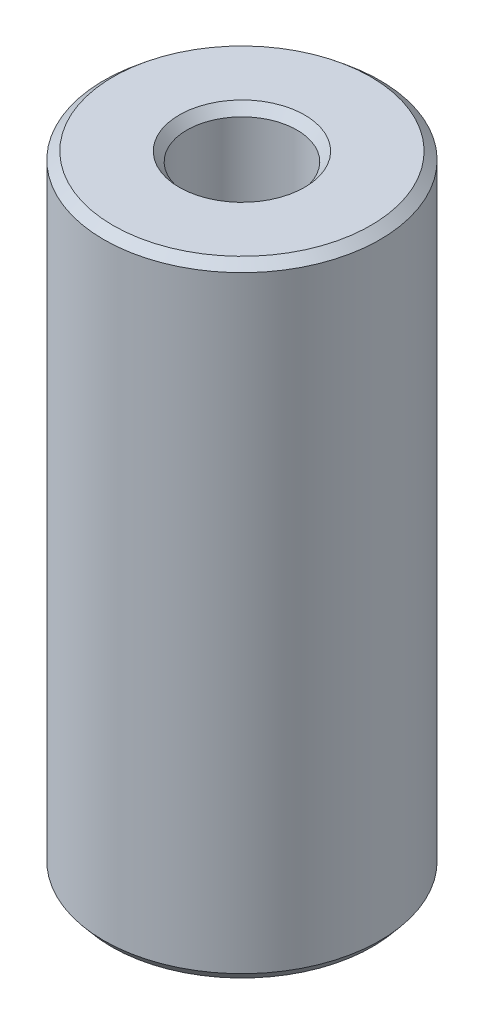
from build123d import *
from OCP.BRepFilletAPI import BRepFilletAPI_MakeChamfer

# Parameters (mm, degrees)
SKETCH1_R           = 17.5
BOSS_EXTRUDE1_DEPTH = 79.117678604
SKETCH2_R           = 6.978931383
CUT_EXTRUDE1_DEPTH  = 83.898172885
CHAMFER1_SIZE       = 0.973704251
CHAMFER1_SIZE2      = 1.167444836


with BuildPart() as part:
    # Sketch1 → Boss-Extrude1 (new body)
    with BuildSketch(Plane(origin=(0, 0, 0), x_dir=(1, 0, 0), z_dir=(0, 1, 0))):
        Circle(SKETCH1_R)
    extrude(amount=BOSS_EXTRUDE1_DEPTH)

    # Sketch2 → Cut-Extrude1 (cut, through all)
    with BuildSketch(Plane(origin=(0, 0, 0), x_dir=(1, 0, 0), z_dir=(0, 1, 0))):
        Circle(SKETCH2_R)
    extrude(amount=CUT_EXTRUDE1_DEPTH, mode=Mode.SUBTRACT)

    # Chamfer1: one chamfer whose edges measure the first distance from different faces: ONE call of the kernel's chamfer builder (chamfer() names one face for all edges)
    chamfer1_edges_1 = [part.edges().sort_by_distance(p)[0] for p in [
        (-6.978931383, 79.117678604, 0),
    ]]
    chamfer1_side_1 = [part.faces().sort_by_distance(p)[0] for p in [
        (-17.005025253, 79.117678604, 0),
    ]]
    chamfer1_edges_2 = [part.edges().sort_by_distance(p)[0] for p in [
        (-6.978931383, 0, 0),
    ]]
    chamfer1_side_2 = [part.faces().sort_by_distance(p)[0] for p in [
        (-6.978931383, 39.558839302, 0),
    ]]
    chamfer1_edges_3 = [part.edges().sort_by_distance(p)[0] for p in [
        (-17.5, 0, 0),
    ]]
    chamfer1_side_3 = [part.faces().sort_by_distance(p)[0] for p in [
        (-17.005025253, 0, 0),
    ]]
    chamfer1_edges_4 = [part.edges().sort_by_distance(p)[0] for p in [
        (-17.5, 79.117678604, 0),
    ]]
    chamfer1_side_4 = [part.faces().sort_by_distance(p)[0] for p in [
        (-17.5, 39.558839302, 0),
    ]]
    chamfer1 = BRepFilletAPI_MakeChamfer(part.part.solid().wrapped)
    for e in chamfer1_edges_1:
        chamfer1.Add(CHAMFER1_SIZE, CHAMFER1_SIZE2, e.wrapped, chamfer1_side_1[0].wrapped)  # the first distance lies on this face
    for e in chamfer1_edges_2:
        chamfer1.Add(CHAMFER1_SIZE, CHAMFER1_SIZE2, e.wrapped, chamfer1_side_2[0].wrapped)  # the first distance lies on this face
    for e in chamfer1_edges_3:
        chamfer1.Add(CHAMFER1_SIZE, CHAMFER1_SIZE2, e.wrapped, chamfer1_side_3[0].wrapped)  # the first distance lies on this face
    for e in chamfer1_edges_4:
        chamfer1.Add(CHAMFER1_SIZE, CHAMFER1_SIZE2, e.wrapped, chamfer1_side_4[0].wrapped)  # the first distance lies on this face
    add(Compound.cast(chamfer1.Shape()), mode=Mode.REPLACE)


solid = part.part
